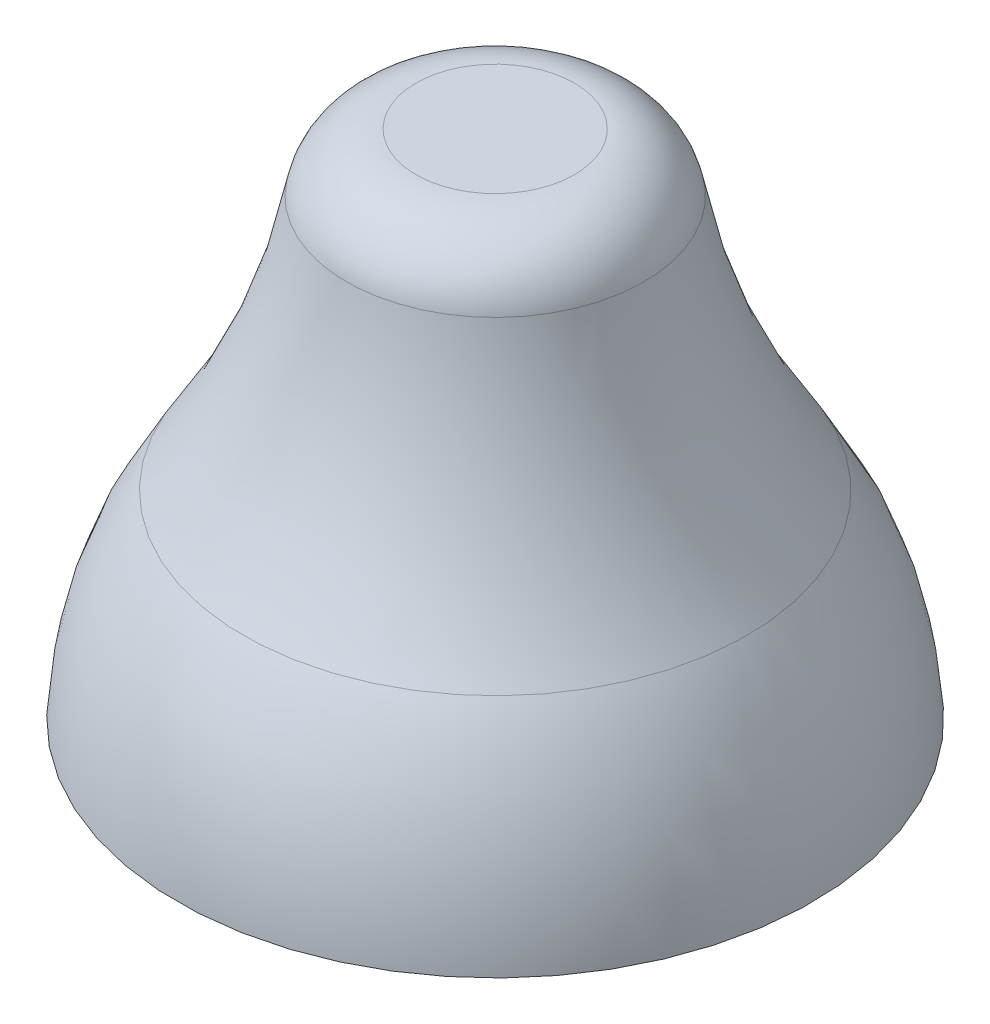
from build123d import *

# Parameters (mm, degrees)
SKETCH2_R          = 0.5
CUT_EXTRUDE1_DEPTH = 0.5


with BuildPart() as part:
    # Sketch1 → Revolve1 (revolve)
    with BuildSketch(Plane.XY):
        with BuildLine():
            Line((0, 0), (0.9, 0))
            ThreePointArc((0.9, 0), (0.845516269, 0.293747377), (0.714, 0.562))
            ThreePointArc((0.714, 0.562), (0.530467505, 0.908354602), (0.421913687, 1.285))
            ThreePointArc((0.421913687, 1.285), (0.353452326, 1.403297097), (0.225, 1.45))
            Line((0.225, 1.45), (0, 1.45))
            Line((0, 1.45), (0, 0))
        make_face()
    revolve(axis=Axis((0, 0, 0), (0, 1, 0)))

    # Sketch2 → Cut-Extrude1 (cut)
    with BuildSketch(Plane.XZ):
        Circle(SKETCH2_R)
    extrude(amount=-CUT_EXTRUDE1_DEPTH, mode=Mode.SUBTRACT)


solid = part.part
